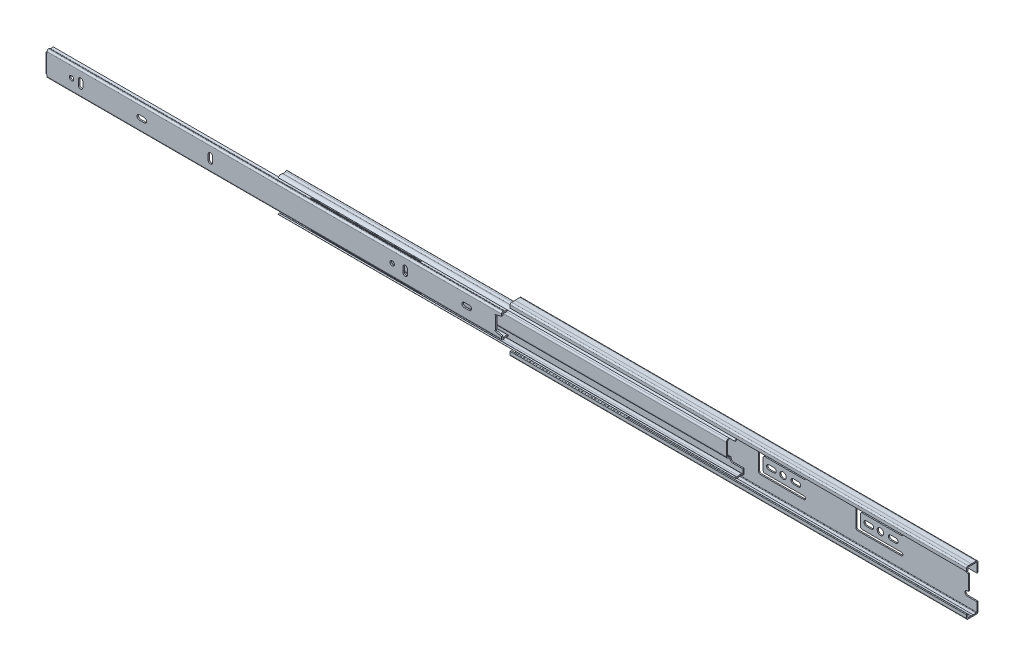
from build123d import *
from build123d.topology import SkipClean

# Parameters (mm, degrees)
EXTRUDE1_DEPTH      = 225.044
MIDDLE_MEMBER_DEPTH = 450.088
DRAWER_START        = -450.088
DRAWER_MEMBER_DEPTH = 450.088
SKETCH6_W           = 1.905
SKETCH6_H           = 12.147486483
CUT_EXTRUDE1_DEPTH  = 683.743710609
EXTRUDE4_DEPTH      = 8.89
CUT_EXTRUDE2_DEPTH  = 1.1938
CUT_EXTRUDE3_DEPTH  = 1.397
CUT_EXTRUDE4_DEPTH  = 683.660285626
CUT_EXTRUDE5_DEPTH  = 1.1938
CUT_EXTRUDE14_DEPTH = 1.1938
CUT_EXTRUDE6_DEPTH  = 1.1938
CUT_E_DEPTH         = 1.1938
SKETCH24_R          = 2.1844
CUT_EXTRUDE13_DEPTH = 1.397
CUT_D_DEPTH         = 1.397
SKETCH36_R          = 2.1844
CUT_B_DEPTH         = 1.397
LPATTERN1_COUNT     = 6
LPATTERN1_PITCH     = 19.05
EXTRUDE7_DEPTH      = 6.35
EXTRUDE7_DEPTH_BACK = 101.6
SKETCH28_W          = 7.62
SKETCH28_H          = 0.762
LPATTERN2_COUNT     = 6
LPATTERN2_PITCH     = 19.05
EXTRUDE8_DEPTH      = 6.35
EXTRUDE8_DEPTH_BACK = 101.6
SKETCH30_W          = 5.08
SKETCH30_H          = 0.762


# Read off the part's stored shape, not the designer's step: Drawer Member
with BuildPart() as part:
    # Sketch1 → Extrude1 (new, symmetric)
    with BuildSketch(Plane(origin=(0, 0, 0), x_dir=(0, 0, -1), z_dir=(1, 0, 0))):
        with BuildLine():
            Line((-4.139279899, 22.8203125), (-0.743323143, 22.698920454))
            Line((-0.743323143, 22.698920454), (3.892452069, 22.8203125))
            ThreePointArc((3.892452069, 22.8203125), (5.124499805, 22.338098312), (5.6388, 21.119095664))
            Line((5.6388, 21.119095664), (5.6388, 0))
            Line((5.6388, 0), (4.445, 0))
            Line((4.445, 0), (4.445, 21.119095664))
            ThreePointArc((4.445, 21.119095664), (4.291477554, 21.482977052), (3.92370211, 21.626921585))
            Line((3.92370211, 21.626921585), (0.761857041, 21.544125758))
            ThreePointArc((0.761857041, 21.544125758), (-0.187154328, 21.71413397), (-1.131158407, 21.51822157))
            Line((-1.131158407, 21.51822157), (-4.181926298, 21.627274477))
            ThreePointArc((-4.181926298, 21.627274477), (-4.367367911, 21.55622161), (-4.445, 21.3734366))
            Line((-4.445, 21.3734366), (-4.445, 18.415))
            Line((-4.445, 18.415), (-5.6388, 18.415))
            Line((-5.6388, 18.415), (-5.6388, 21.3734366))
            ThreePointArc((-5.6388, 21.3734366), (-5.19629709, 22.415311161), (-4.139279899, 22.8203125))
        make_face()
    extrude(amount=EXTRUDE1_DEPTH, both=True)

    # Sketch8 → Cut-Extrude2 (cut)
    with BuildSketch(Plane.XY.offset(-4.445)):
        with BuildLine():
            Line((215.405533997, 7.645578895), (216.8398, 7.493000005))
            Line((216.8398, 7.493000005), (216.8398, 0))
            Line((216.8398, 0), (225.044, 0))
            Line((225.044, 0), (225.044, 12.204752384))
            Line((225.044, 12.204752384), (215.647356843, 12.204752384))
            ThreePointArc((215.647356843, 12.204752384), (213.364565723, 10.03983377), (215.405533997, 7.645578895))
        make_face()
    extrude(amount=-CUT_EXTRUDE2_DEPTH, mode=Mode.SUBTRACT)

    # Sketch13 → Cut-Extrude5 (cut)
    with BuildSketch(Plane.XY.offset(-4.445)):
        with BuildLine():
            Line((-156.655699917, 7.112000069), (-181.484199931, 7.112000069))
            ThreePointArc((-181.484199931, 7.112000069), (-182.023015347, 6.888815416), (-182.2462, 6.35))
            Line((-182.2462, 6.35), (-182.2462, 0))
            Line((-182.2462, 0), (-184.5322, 0))
            Line((-184.5322, 0), (-184.5322, 6.35))
            ThreePointArc((-184.5322, 6.35), (-184.755384653, 6.888815416), (-185.294200069, 7.112000069))
            Line((-185.294200069, 7.112000069), (-207.582699917, 7.112000069))
            ThreePointArc((-207.582699917, 7.112000069), (-209.170199917, 8.699500069), (-207.582699917, 10.287000069))
            Line((-207.582699917, 10.287000069), (-156.655699917, 10.287000069))
            ThreePointArc((-156.655699917, 10.287000069), (-155.068199917, 8.699500069), (-156.655699917, 7.112000069))
        make_face()
        with BuildLine():
            Line((-162.269099917, 2.286), (-167.222099917, 2.286))
            ThreePointArc((-167.222099917, 2.286), (-168.838546018, 1.616446102), (-169.508099917, 0))
            Line((-169.508099917, 0), (-159.983099917, 0))
            ThreePointArc((-159.983099917, 0), (-160.652653815, 1.616446102), (-162.269099917, 2.286))
        make_face()
        with BuildLine():
            Line((-201.321599917, 0), (-196.749599917, 0))
            ThreePointArc((-196.749599917, 0), (-199.035599917, 2.286), (-201.321599917, 0))
        make_face()
        with BuildLine():
            Line((-193.219000083, 0), (-186.868999917, 0))
            ThreePointArc((-186.868999917, 0), (-190.044, 3.175000083), (-193.219000083, 0))
        make_face()
        with BuildLine():
            Line((-179.731599917, 0), (-175.159599917, 0))
            ThreePointArc((-175.159599917, 0), (-177.445599917, 2.286), (-179.731599917, 0))
        make_face()
    extrude(amount=-CUT_EXTRUDE5_DEPTH, mode=Mode.SUBTRACT)

    # Sketch32 → Cut-Extrude14 (cut)
    with BuildSketch(Plane(origin=(0, 0, -5.6388), x_dir=(-1, 0, 0), z_dir=(0, 0, -1))):
        with BuildLine():
            Line((44.5815, 0), (54.1065, 0))
            ThreePointArc((54.1065, 0), (53.436946102, 1.616446102), (51.8205, 2.286))
            Line((51.8205, 2.286), (46.8675, 2.286))
            ThreePointArc((46.8675, 2.286), (45.251053898, 1.616446102), (44.5815, 0))
        make_face()
        with BuildLine():
            Line((58.869, 0), (65.219, 0))
            ThreePointArc((65.219, 0), (62.044, 3.175), (58.869, 0))
        make_face()
        with BuildLine():
            Line((68.7115, 0), (78.2365, 0))
            ThreePointArc((78.2365, 0), (77.566946102, 1.616446102), (75.9505, 2.286))
            Line((75.9505, 2.286), (70.9975, 2.286))
            ThreePointArc((70.9975, 2.286), (69.381053898, 1.616446102), (68.7115, 0))
        make_face()
        with BuildLine():
            Line((81.602, 0), (86.174, 0))
            Line((86.174, 0), (86.174, 8.763000069))
            ThreePointArc((86.174, 8.763000069), (85.727630735, 9.840630803), (84.65, 10.287000069))
            Line((84.65, 10.287000069), (41.4065, 10.287000069))
            ThreePointArc((41.4065, 10.287000069), (39.819, 8.699500069), (41.4065, 7.112000069))
            Line((41.4065, 7.112000069), (80.078, 7.112000069))
            ThreePointArc((80.078, 7.112000069), (81.155630735, 6.665630803), (81.602, 5.588000069))
            Line((81.602, 5.588000069), (81.602, 0))
        make_face()
    extrude(amount=-CUT_EXTRUDE14_DEPTH, mode=Mode.SUBTRACT)

    # Sketch33 → Cut-Extrude6 (cut)
    with BuildSketch(Plane(origin=(83.609365602, 0.812450965, -5.6388), x_dir=(-1, 0, 0), z_dir=(0, 0, -1))):
        with BuildLine():
            Line((32.190865602, -0.812450965), (41.715865602, -0.812450965))
            ThreePointArc((41.715865602, -0.812450965), (41.046311704, 0.803995136), (39.429865602, 1.473549035))
            Line((39.429865602, 1.473549035), (34.476865602, 1.473549035))
            ThreePointArc((34.476865602, 1.473549035), (32.8604195, 0.803995136), (32.190865602, -0.812450965))
        make_face()
        with BuildLine():
            Line((46.478365602, -0.812450965), (52.828365602, -0.812450965))
            ThreePointArc((52.828365602, -0.812450965), (49.653365602, 2.362549035), (46.478365602, -0.812450965))
        make_face()
        with BuildLine():
            Line((56.320865602, -0.812450965), (65.845865602, -0.812450965))
            ThreePointArc((65.845865602, -0.812450965), (65.176311704, 0.803995136), (63.559865602, 1.473549035))
            Line((63.559865602, 1.473549035), (58.606865602, 1.473549035))
            ThreePointArc((58.606865602, 1.473549035), (56.9904195, 0.803995136), (56.320865602, -0.812450965))
        make_face()
        with BuildLine():
            Line((69.211365602, -0.812450965), (73.783365602, -0.812450965))
            Line((73.783365602, -0.812450965), (73.783365602, 7.950549103))
            ThreePointArc((73.783365602, 7.950549103), (73.336996337, 9.028179838), (72.259365602, 9.474549103))
            Line((72.259365602, 9.474549103), (29.015865602, 9.474549103))
            ThreePointArc((29.015865602, 9.474549103), (27.428365602, 7.887049103), (29.015865602, 6.299549103))
            Line((29.015865602, 6.299549103), (67.687365602, 6.299549103))
            ThreePointArc((67.687365602, 6.299549103), (68.764996337, 5.853179838), (69.211365602, 4.775549103))
            Line((69.211365602, 4.775549103), (69.211365602, -0.812450965))
        make_face()
    extrude(amount=-CUT_EXTRUDE6_DEPTH, mode=Mode.SUBTRACT)

    # Sketch34 → Cut E (cut)
    with BuildSketch(Plane(origin=(169.823604257, 1.452669916, -5.6388), x_dir=(-1, 0, 0), z_dir=(0, 0, -1))):
        with BuildLine():
            Line((22.365104257, -1.452669916), (31.890104257, -1.452669916))
            ThreePointArc((31.890104257, -1.452669916), (31.220550358, 0.163776186), (29.604104257, 0.833330084))
            Line((29.604104257, 0.833330084), (24.651104257, 0.833330084))
            ThreePointArc((24.651104257, 0.833330084), (23.034658155, 0.163776186), (22.365104257, -1.452669916))
        make_face()
        with BuildLine():
            Line((36.652604257, -1.452669916), (43.002604257, -1.452669916))
            ThreePointArc((43.002604257, -1.452669916), (39.827604257, 1.722330084), (36.652604257, -1.452669916))
        make_face()
        with BuildLine():
            Line((46.495104257, -1.452669916), (56.020104257, -1.452669916))
            ThreePointArc((56.020104257, -1.452669916), (55.350550358, 0.163776186), (53.734104257, 0.833330084))
            Line((53.734104257, 0.833330084), (48.781104257, 0.833330084))
            ThreePointArc((48.781104257, 0.833330084), (47.164658155, 0.163776186), (46.495104257, -1.452669916))
        make_face()
        with BuildLine():
            Line((59.385604257, -1.452669916), (63.957604257, -1.452669916))
            Line((63.957604257, -1.452669916), (63.957604257, 7.310330153))
            ThreePointArc((63.957604257, 7.310330153), (63.511234991, 8.387960887), (62.433604257, 8.834330153))
            Line((62.433604257, 8.834330153), (19.190104257, 8.834330153))
            ThreePointArc((19.190104257, 8.834330153), (17.602604257, 7.246830153), (19.190104257, 5.659330153))
            Line((19.190104257, 5.659330153), (57.861604257, 5.659330153))
            ThreePointArc((57.861604257, 5.659330153), (58.939234991, 5.212960887), (59.385604257, 4.135330153))
            Line((59.385604257, 4.135330153), (59.385604257, -1.452669916))
        make_face()
    extrude(amount=-CUT_E_DEPTH, mode=Mode.SUBTRACT)

    # Mirror3 3: part across plane


with BuildPart() as body_2:
    # Sketch2 → Middle Member (new body)
    with BuildSketch(Plane.ZY.offset(453.644)):
        with BuildLine():
            ThreePointArc((5.7404, 15.627692517), (3.735864231, 17.127444277), (1.241474216, 16.914283663))
            ThreePointArc((1.241474216, 16.914283663), (-0.188944013, 16.688900955), (-1.505642365, 17.291560999))
            ThreePointArc((-1.505642365, 17.291560999), (-2.813430342, 17.487614783), (-3.53059999, 16.376572852))
            Line((-3.53059999, 16.376572852), (-3.53059999, 9.521737984))
            ThreePointArc((-3.53059999, 9.521737984), (-3.220327109, 8.457239952), (-2.386691239, 7.726160915))
            Line((-2.386691239, 7.726160915), (-0.414564934, 6.806543316))
            ThreePointArc((-0.414564934, 6.806543316), (-0.093935732, 6.525359052), (0.0254, 6.115936705))
            Line((0.0254, 6.115936705), (0.0254, 0))
            Line((0.0254, 0), (1.2446, 0))
            Line((1.2446, 0), (1.2446, 6.115936705))
            ThreePointArc((1.2446, 6.115936705), (0.934327119, 7.180434735), (0.100691251, 7.91151377))
            Line((0.100691251, 7.91151377), (-1.871435054, 8.831131369))
            ThreePointArc((-1.871435054, 8.831131369), (-2.192064258, 9.112315634), (-2.31139999, 9.521737984))
            Line((-2.31139999, 9.521737984), (-2.31139999, 16.376572852))
            ThreePointArc((-2.31139999, 16.376572852), (-2.311399987, 16.376572856), (-2.311399982, 16.376572855))
            ThreePointArc((-2.311399982, 16.376572855), (-0.35482671, 15.481038557), (1.770730805, 15.815950333))
            ThreePointArc((1.770730805, 15.815950333), (3.400639083, 15.955235789), (4.710462095, 14.975253591))
            Line((4.710462095, 14.975253591), (5.7404, 15.627692517))
        make_face()
    extrude(amount=-MIDDLE_MEMBER_DEPTH)

    # Sketch12 → Cut-Extrude4 (cut, through all)
    with BuildSketch(Plane.XY.offset(1.2446)):
        with BuildLine():
            Line((-3.556, 12.065), (-13.716, 12.065))
            ThreePointArc((-13.716, 12.065), (-15.512051224, 11.321051224), (-16.256, 9.525))
            Line((-16.256, 9.525), (-16.256, 0))
            Line((-16.256, 0), (-3.556, 0))
            Line((-3.556, 0), (-3.556, 12.065))
        make_face()
    extrude(amount=-CUT_EXTRUDE4_DEPTH, mode=Mode.SUBTRACT)

    # Mirror3 2: body 2 across plane


with BuildPart() as body_3:
    # Drawer Member outline → Drawer Member (new body)
    with BuildSketch(Plane.ZY.offset(682.244).offset(DRAWER_START)):
        with BuildLine():
            Line((5.6642, 0), (7.0612, 0))
            Line((7.0612, 0), (7.0612, 10.623486483))
            ThreePointArc((7.0612, 10.623486483), (6.614830734, 11.701117218), (5.5372, 12.147486483))
            Line((5.5372, 12.147486483), (5.164341455, 12.147486483))
            ThreePointArc((5.164341455, 12.147486483), (4.67440708, 12.066587417), (4.236487447, 11.83247901))
            ThreePointArc((4.236487447, 11.83247901), (2.709144677, 11.334862777), (1.208194452, 11.907179363))
            Line((1.208194452, 11.907179363), (0.304054167, 10.842219578))
            ThreePointArc((0.304054167, 10.842219578), (2.674694689, 9.938287609), (5.087020295, 10.724235863))
            ThreePointArc((5.087020295, 10.724235863), (5.123513594, 10.743744895), (5.164341455, 10.750486483))
            Line((5.164341455, 10.750486483), (5.5372, 10.750486483))
            ThreePointArc((5.5372, 10.750486483), (5.627002561, 10.713289044), (5.6642, 10.623486483))
            Line((5.6642, 10.623486483), (5.6642, 0))
        make_face()
    extrude(amount=DRAWER_MEMBER_DEPTH)

    # Sketch6 → Cut-Extrude1 (cut, through all)
    with BuildSketch(Plane.XY.offset(7.0612)):
        with Locations((-681.2915, 6.073743242)):
            Rectangle(SKETCH6_W, SKETCH6_H)
    extrude(amount=-CUT_EXTRUDE1_DEPTH, mode=Mode.SUBTRACT)

    # Sketch7 → Extrude4 (add)
    with BuildSketch(Plane.XZ):
        with BuildLine():
            Line((-680.339, 7.0612), (-680.593, 7.0612))
            ThreePointArc((-680.593, 7.0612), (-681.760433296, 6.577633296), (-682.244, 5.4102))
            Line((-682.244, 5.4102), (-682.244, 0.304054167))
            Line((-682.244, 0.304054167), (-680.847, 0.304054167))
            Line((-680.847, 0.304054167), (-680.847, 5.4102))
            ThreePointArc((-680.847, 5.4102), (-680.772605122, 5.589805122), (-680.593, 5.6642))
            Line((-680.593, 5.6642), (-680.339, 5.6642))
            Line((-680.339, 5.6642), (-680.339, 7.0612))
        make_face()
    extrude(amount=-EXTRUDE4_DEPTH)

    # Sketch11 → Cut-Extrude3 (cut)
    with BuildSketch(Plane.XY.offset(7.0612)):
        with BuildLine():
            Line((-237.870951398, 5.967847879), (-237.871, 0))
            Line((-237.871, 0), (-232.156, 0))
            Line((-232.156, 0), (-232.156, 8.589285844))
            Line((-232.156, 8.589285844), (-238.015326457, 7.221216084))
            ThreePointArc((-238.015326457, 7.221216084), (-238.501774848, 6.530182899), (-237.870951398, 5.967847879))
        make_face()
    extrude(amount=-CUT_EXTRUDE3_DEPTH, mode=Mode.SUBTRACT)

    # Sketch24 → Cut-Extrude13 (cut)
    with BuildSketch(Plane.XY.offset(7.0612)):
        with Locations((-656.082, 0)):
            Circle(SKETCH24_R)
        with BuildLine():
            Line((-649.3764, 2.6416), (-649.3764, 0))
            Line((-649.3764, 0), (-645.0076, 0))
            Line((-645.0076, 0), (-645.0076, 2.6416))
            ThreePointArc((-645.0076, 2.6416), (-647.192, 4.826), (-649.3764, 2.6416))
        make_face()
        with BuildLine():
            Line((-591.5025, 0), (-581.9775, 0))
            ThreePointArc((-581.9775, 0), (-582.647053898, 1.616446102), (-584.2635, 2.286))
            Line((-584.2635, 2.286), (-589.2165, 2.286))
            ThreePointArc((-589.2165, 2.286), (-590.832946102, 1.616446102), (-591.5025, 0))
        make_face()
        with BuildLine():
            Line((-521.3764, 2.6416), (-521.3764, 0))
            Line((-521.3764, 0), (-517.0076, 0))
            Line((-517.0076, 0), (-517.0076, 2.6416))
            ThreePointArc((-517.0076, 2.6416), (-519.192, 4.826), (-521.3764, 2.6416))
        make_face()
    extrude(amount=-CUT_EXTRUDE13_DEPTH, mode=Mode.SUBTRACT)

    # Sketch25 → Cut D (cut)
    with BuildSketch(Plane.XY.offset(7.0612)):
        with BuildLine():
            Line((-261.6835, 0), (-271.2085, 0))
            ThreePointArc((-271.2085, 0), (-270.538946102, 1.616446102), (-268.9225, 2.286))
            Line((-268.9225, 2.286), (-263.9695, 2.286))
            ThreePointArc((-263.9695, 2.286), (-262.353053898, 1.616446102), (-261.6835, 0))
        make_face()
    extrude(amount=-CUT_D_DEPTH, mode=Mode.SUBTRACT)

    # Sketch36 → Cut B (cut)
    with BuildSketch(Plane.XY.offset(7.0612)):
        with Locations((-339.852, 0)):
            Circle(SKETCH36_R)
        with BuildLine():
            Line((-329.3364, 0), (-324.9676, 0))
            Line((-324.9676, 0), (-324.9676, 2.6416))
            ThreePointArc((-324.9676, 2.6416), (-327.152, 4.826), (-329.3364, 2.6416))
            Line((-329.3364, 2.6416), (-329.3364, 0))
        make_face()
    extrude(amount=-CUT_B_DEPTH, mode=Mode.SUBTRACT)

    # Mirror3: body 3 across plane


with BuildPart() as body_4:
    # Sketch27 → Revolve1 (revolve)
    with BuildSketch(Plane.ZY.offset(212.344)):
        with BuildLine():
            Line((0.1524, 21.683172421), (0.1524, 16.665571078))
            ThreePointArc((0.1524, 16.665571078), (2.661200671, 19.174371749), (0.1524, 21.683172421))
        make_face()
    revolve(axis=Axis((-212.344, 23.635004298, 0.1524), (0, -1, 0)))


with BuildPart() as lpattern1_1:
    # LPattern1: pattern copy
    add(body_4.part.moved(Location(Vector(1, 0, 0) * (1 * LPATTERN1_PITCH))))


with BuildPart() as lpattern1_2:
    # LPattern1: pattern copy
    add(body_4.part.moved(Location(Vector(1, 0, 0) * (2 * LPATTERN1_PITCH))))


with BuildPart() as lpattern1_3:
    # LPattern1: pattern copy
    add(body_4.part.moved(Location(Vector(1, 0, 0) * (3 * LPATTERN1_PITCH))))


with BuildPart() as lpattern1_4:
    # LPattern1: pattern copy
    add(body_4.part.moved(Location(Vector(1, 0, 0) * (4 * LPATTERN1_PITCH))))


with BuildPart() as lpattern1_5:
    # LPattern1: pattern copy
    add(body_4.part.moved(Location(Vector(1, 0, 0) * (5 * LPATTERN1_PITCH))))


with BuildPart() as body_4_1:
    add(body_4.part)

    add(lpattern1_1.part)  # Extrude7 merges LPattern1_1

    add(lpattern1_2.part)  # Extrude7 merges LPattern1_2

    add(lpattern1_3.part)  # Extrude7 merges LPattern1_3

    add(lpattern1_4.part)  # Extrude7 merges LPattern1_4

    add(lpattern1_5.part)  # Extrude7 merges LPattern1_5
    # Sketch28 → Extrude7 (add, two sides: drawn at the far end of the back side and taken through both)
    with BuildSketch(Plane.ZY.offset(212.344).offset(-EXTRUDE7_DEPTH_BACK)):
        with Locations((0.1524, 19.174371749)):
            Rectangle(SKETCH28_W, SKETCH28_H)
    extrude(amount=EXTRUDE7_DEPTH + EXTRUDE7_DEPTH_BACK)


with BuildPart() as body_5:
    # Sketch29 → Revolve2 (revolve)
    with BuildSketch(Plane.ZY.offset(415.544)):
        with BuildLine():
            Line((2.7686, 16.043834368), (2.7686, 11.446434358))
            ThreePointArc((2.7686, 11.446434358), (5.067300005, 13.745134363), (2.7686, 16.043834368))
        make_face()
    revolve(axis=Axis((-415.544, 16.680143034, 2.7686), (0, -1, 0)))


with BuildPart() as lpattern2_1:
    # LPattern2: pattern copy
    add(body_5.part.moved(Location(Vector(1, 0, 0) * (1 * LPATTERN2_PITCH))))


with BuildPart() as lpattern2_2:
    # LPattern2: pattern copy
    add(body_5.part.moved(Location(Vector(1, 0, 0) * (2 * LPATTERN2_PITCH))))


with BuildPart() as lpattern2_3:
    # LPattern2: pattern copy
    add(body_5.part.moved(Location(Vector(1, 0, 0) * (3 * LPATTERN2_PITCH))))


with BuildPart() as lpattern2_4:
    # LPattern2: pattern copy
    add(body_5.part.moved(Location(Vector(1, 0, 0) * (4 * LPATTERN2_PITCH))))


with BuildPart() as lpattern2_5:
    # LPattern2: pattern copy
    add(body_5.part.moved(Location(Vector(1, 0, 0) * (5 * LPATTERN2_PITCH))))


with BuildPart() as body_5_1:
    add(body_5.part)

    add(lpattern2_1.part)  # Extrude8 merges LPattern2_1

    add(lpattern2_2.part)  # Extrude8 merges LPattern2_2

    add(lpattern2_3.part)  # Extrude8 merges LPattern2_3

    add(lpattern2_4.part)  # Extrude8 merges LPattern2_4

    add(lpattern2_5.part)  # Extrude8 merges LPattern2_5
    # Sketch30 → Extrude8 (add, two sides: drawn at the far end of the back side and taken through both)
    with BuildSketch(Plane.ZY.offset(415.544).offset(-EXTRUDE8_DEPTH_BACK)):
        with Locations((2.7686, 13.745134363)):
            Rectangle(SKETCH30_W, SKETCH30_H)
    extrude(amount=EXTRUDE8_DEPTH + EXTRUDE8_DEPTH_BACK)


with BuildPart() as body_3_1:
    with SkipClean():  # the faces are left unmerged after this step: merging them gives an invalid solid
        add(body_3.part)
        add(body_3.part.mirror(Plane.ZX))


with BuildPart() as body_2_1:
    add(body_2.part)
    add(body_2.part.mirror(Plane.ZX))


with BuildPart() as part_1:
    with SkipClean():  # the faces are left unmerged after this step: merging them gives an invalid solid
        add(part.part)
        add(part.part.mirror(Plane.ZX))


with BuildPart() as body_6:
    # Mirror5: mirrored copy
    add(body_5_1.part.mirror(Plane.ZX))


with BuildPart() as body_7:
    # Mirror5 2: mirrored copy
    add(body_4_1.part.mirror(Plane.ZX))


solid = Compound([body_4_1.part, body_5_1.part, body_3_1.part, body_2_1.part, part_1.part, body_6.part, body_7.part])
